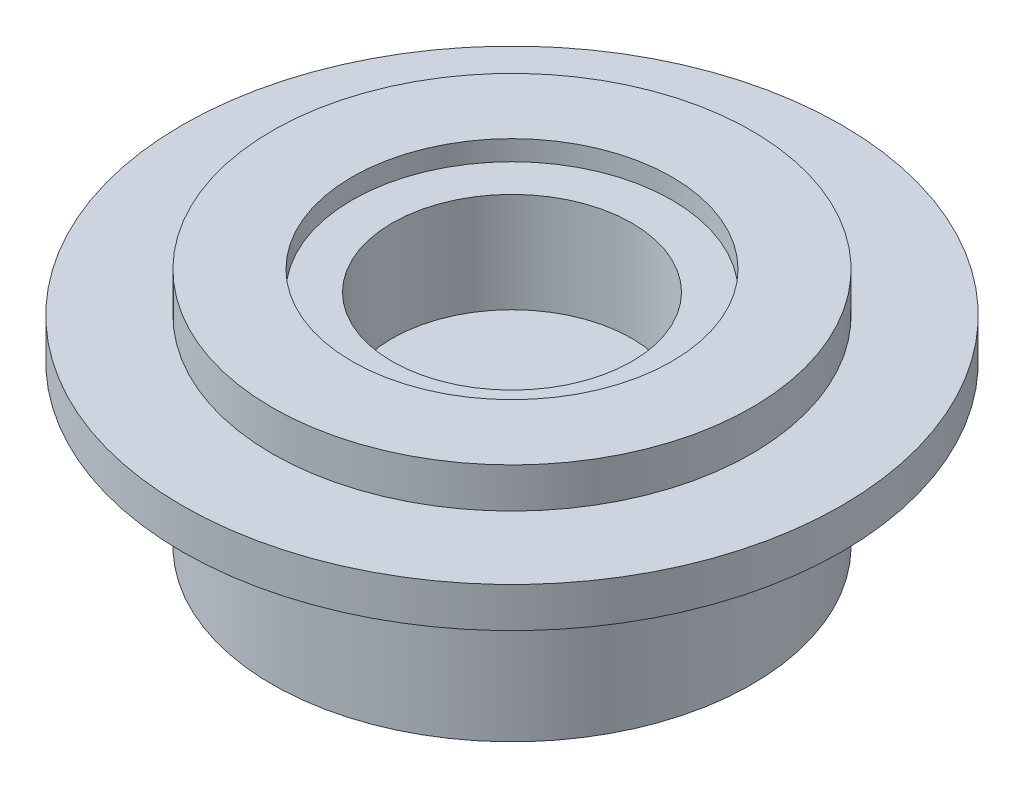
from build123d import *

# Parameters (mm, degrees)
SKETCH2_R           = 16.5
BOSS_EXTRUDE1_DEPTH = 1
SKETCH3_R           = 12
BOSS_EXTRUDE2_DEPTH = 8
BOSS_EXTRUDE3_START = 2
SKETCH4_R           = 12
BOSS_EXTRUDE3_DEPTH = 2
SKETCH5_R           = 6
CUT_EXTRUDE1_DEPTH  = 6
SKETCH6_R           = 8
CUT_EXTRUDE2_DEPTH  = 1


with BuildPart() as part:
    # Sketch2 → Boss-Extrude1 (new, symmetric)
    with BuildSketch(Plane(origin=(0, 0, 0), x_dir=(1, 0, 0), z_dir=(0, 1, 0))):
        Circle(SKETCH2_R)
    extrude(amount=BOSS_EXTRUDE1_DEPTH, both=True)

    # Sketch3 → Boss-Extrude2 (add)
    with BuildSketch(Plane.XZ.offset(1)):
        Circle(SKETCH3_R)
    extrude(amount=BOSS_EXTRUDE2_DEPTH)

    # Sketch4 → Boss-Extrude3 (add)
    with BuildSketch(Plane(origin=(0, 1, 0), x_dir=(1, 0, 0), z_dir=(0, 1, 0)).offset(BOSS_EXTRUDE3_START)):
        Circle(SKETCH4_R)
    extrude(amount=-BOSS_EXTRUDE3_DEPTH)

    # Sketch5 → Cut-Extrude1 (cut)
    with BuildSketch(Plane(origin=(0, 3, 0), x_dir=(1, 0, 0), z_dir=(0, 1, 0))):
        Circle(SKETCH5_R)
    extrude(amount=-CUT_EXTRUDE1_DEPTH, mode=Mode.SUBTRACT)

    # Sketch6 → Cut-Extrude2 (cut)
    with BuildSketch(Plane(origin=(0, 3, 0), x_dir=(1, 0, 0), z_dir=(0, 1, 0))):
        Circle(SKETCH6_R)
    extrude(amount=-CUT_EXTRUDE2_DEPTH, mode=Mode.SUBTRACT)


solid = part.part
